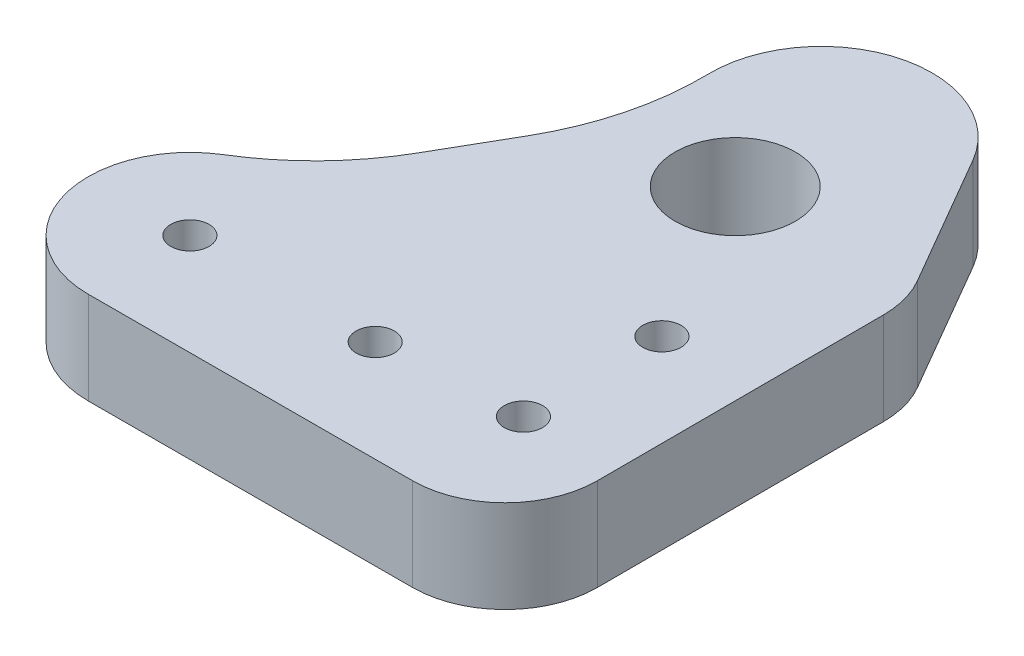
from build123d import *

# Parameters (mm, degrees)
SKETCH1_R           = 2.070000001
SKETCH1_R_2         = 2.07
SKETCH1_R_3         = 6.5
BOSS_EXTRUDE1_DEPTH = 10


with BuildPart() as part:
    # Sketch1 → Boss-Extrude1 (new body)
    with BuildSketch(Plane(origin=(0, 0, 0), x_dir=(1, 0, 0), z_dir=(0, 1, 0))):
        with BuildLine():
            Line((23.703500556, -15.152403716), (23.64205667, 15.828297469))
            ThreePointArc((23.64205667, 15.828297469), (23.296182467, 18.41580704), (22.292396885, 20.825630528))
            Line((22.292396885, 20.825630528), (13.99606221, 35.129712685))
            ThreePointArc((13.99606221, 35.129712685), (0.385615186, 40.666219429), (-8.382044752, 28.875319789))
            ThreePointArc((-8.382044752, 28.875319789), (-9.316904265, 20.837743246), (-12.365890121, 13.342392404))
            Line((-12.365890121, 13.342392404), (-16.723498541, 5.760104356))
            ThreePointArc((-16.723498541, 5.760104356), (-21.220226961, -0.19980824), (-27.049399397, -4.864770548))
            ThreePointArc((-27.049399397, -4.864770548), (-31.881873053, -17.239982686), (-21.276578026, -25.241632171))
            Line((-21.276578026, -25.241632171), (13.723353139, -25.172216965))
            ThreePointArc((13.723353139, -25.172216965), (20.788598117, -22.229266547), (23.703500556, -15.152403716))
        make_face()
        with Locations((-21.298394234, -14.241653805)):
            Circle(SKETCH1_R, mode=Mode.SUBTRACT)
        with Locations((-1.298433568, -14.201987971)):
            Circle(SKETCH1_R_2, mode=Mode.SUBTRACT)
        with Locations((13.69955364, -13.172240563)):
            Circle(SKETCH1_R_2, mode=Mode.SUBTRACT)
        with Locations((13.669804266, 1.827729936)):
            Circle(SKETCH1_R_2, mode=Mode.SUBTRACT)
        with Locations((3.615677553, 19.807825031)):
            Circle(SKETCH1_R_3, mode=Mode.SUBTRACT)
    extrude(amount=BOSS_EXTRUDE1_DEPTH)


solid = part.part
